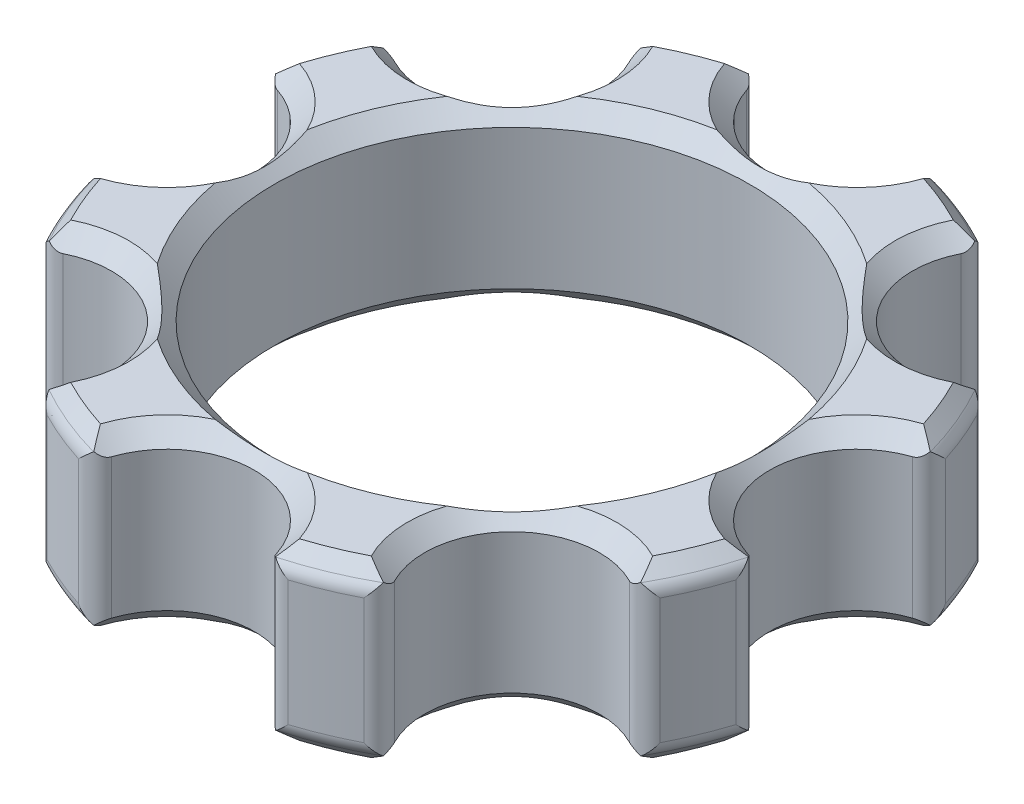
from build123d import *

# Parameters (mm, degrees)
IZIM1_R                     = 13.6
Y_KSEKLIK_EKSTR_ZYON1_DEPTH = 10
PAH1_SIZE                   = 1
RADYUS1_START               = 0.695830358
RADYUS1_2_DEPTH             = 8.608339284


with BuildPart() as part:
    # Çizim1 → Yükseklik-Ekstrüzyon1 (new body)
    with BuildSketch(Plane(origin=(0, 0, 0), x_dir=(1, 0, 0), z_dir=(0, 1, 0))):
        with BuildLine():
            ThreePointArc((19.117088608, -4.959780557), (14.75, 0), (19.117088608, 4.959780557))
            ThreePointArc((19.117088608, 4.959780557), (18.246620767, 7.557997789), (17.024917456, 10.010728526))
            ThreePointArc((17.024917456, 10.010728526), (10.429825023, 10.429825023), (10.010728526, 17.024917456))
            ThreePointArc((10.010728526, 17.024917456), (7.557997789, 18.246620767), (4.959780557, 19.117088608))
            ThreePointArc((4.959780557, 19.117088608), (0, 14.75), (-4.959780557, 19.117088608))
            ThreePointArc((-4.959780557, 19.117088608), (-7.557997789, 18.246620767), (-10.010728526, 17.024917456))
            ThreePointArc((-10.010728526, 17.024917456), (-9.233913483, 15.581967723), (-8.965358928, 13.965358928))
            ThreePointArc((-8.965358928, 13.965358928), (-11.76283681, 9.476606728), (-17.024917456, 10.010728526))
            ThreePointArc((-17.024917456, 10.010728526), (-18.246620767, 7.557997789), (-19.117088608, 4.959780557))
            ThreePointArc((-19.117088608, 4.959780557), (-15.997363796, 3.304197561), (-14.75, 0))
            ThreePointArc((-14.75, 0), (-15.997363796, -3.304197561), (-19.117088608, -4.959780557))
            ThreePointArc((-19.117088608, -4.959780557), (-18.246620767, -7.557997789), (-17.024917456, -10.010728526))
            ThreePointArc((-17.024917456, -10.010728526), (-11.76283681, -9.476606728), (-8.965358928, -13.965358928))
            ThreePointArc((-8.965358928, -13.965358928), (-9.233913483, -15.581967723), (-10.010728526, -17.024917456))
            ThreePointArc((-10.010728526, -17.024917456), (-7.557997789, -18.246620767), (-4.959780557, -19.117088608))
            ThreePointArc((-4.959780557, -19.117088608), (0, -14.75), (4.959780557, -19.117088608))
            ThreePointArc((4.959780557, -19.117088608), (7.557997789, -18.246620767), (10.010728526, -17.024917456))
            ThreePointArc((10.010728526, -17.024917456), (10.429825023, -10.429825023), (17.024917456, -10.010728526))
            ThreePointArc((17.024917456, -10.010728526), (18.246620767, -7.557997789), (19.117088608, -4.959780557))
        make_face()
        with Locations(Location((0, 0, 0), (0, 0, 270))):
            Circle(IZIM1_R, mode=Mode.SUBTRACT)
    extrude(amount=Y_KSEKLIK_EKSTR_ZYON1_DEPTH)

    # Pah1
    # the kernel refuses this chamfer: 1 mm, written as the material it takes off along each edge
    with BuildSketch(Plane(origin=(0, 10, 0), x_dir=(-0.7889082131099503, 0, -0.6145110505822213), z_dir=(0.6145110505822213, 0, -0.7889082131099503))) as pah1_piece_1:
        Polygon((19.75 - PAH1_SIZE, 0), (19.75, -PAH1_SIZE), (19.75, 0), align=None)
    revolve(axis=Axis((0, 10, 0), (0, 1, 0)), revolution_arc=30.832801882, mode=Mode.SUBTRACT)
    with BuildSketch(Plane(origin=(-19.75, 10, 0), x_dir=(-0.37844204482930704, 0, 0.9256249881595746), z_dir=(-0.9256249881595746, 0, -0.37844204482930704))) as pah1_piece_2:
        Polygon((5 + PAH1_SIZE, 0), (5, -PAH1_SIZE), (5, 0), align=None)
    revolve(axis=Axis((-19.75, 10, 0), (0, 1, 0)), revolution_arc=224.474425336, mode=Mode.SUBTRACT)
    with BuildSketch(Plane(origin=(0, 0, 0), x_dir=(0, 0, 1), z_dir=(-1, 0, 0))) as pah1_piece_3:
        Polygon((13.6, PAH1_SIZE), (13.6 + PAH1_SIZE, 0), (13.6, 0), align=None)
    revolve(axis=Axis((0, 0, 0), (0, 1, 0)), mode=Mode.SUBTRACT)
    with BuildSketch(Plane(origin=(0, 0, 0), x_dir=(-0.1233174162430614, 0, -0.9923672782045645), z_dir=(0.9923672782045645, 0, -0.1233174162430614))) as pah1_piece_4:
        Polygon((19.75, PAH1_SIZE), (19.75 - PAH1_SIZE, 0), (19.75, 0), align=None)
    revolve(axis=Axis((0, 0, 0), (0, 1, 0)), revolution_arc=30.832801882, mode=Mode.SUBTRACT)
    with BuildSketch(Plane(origin=(0, 0, -19.75), x_dir=(0.9256249881595718, 0, -0.3784420448293139), z_dir=(-0.3784420448293139, 0, -0.9256249881595718))) as pah1_piece_5:
        Polygon((5, -PAH1_SIZE), (5 + PAH1_SIZE, 0), (5, 0), align=None)
    revolve(axis=Axis((0, 0, -19.75), (0, -1, 0)), revolution_arc=224.474425336, mode=Mode.SUBTRACT)
    with BuildSketch(Plane(origin=(0, 0, 0), x_dir=(0.6145110505822075, 0, -0.7889082131099611), z_dir=(0.7889082131099611, 0, 0.6145110505822075))) as pah1_piece_6:
        Polygon((19.75, PAH1_SIZE), (19.75 - PAH1_SIZE, 0), (19.75, 0), align=None)
    revolve(axis=Axis((0, 0, 0), (0, 1, 0)), revolution_arc=30.832801882, mode=Mode.SUBTRACT)
    with BuildSketch(Plane(origin=(13.965358928, 0, -13.965358928), x_dir=(0.922114642148259, 0, 0.3869167697784474), z_dir=(0.3869167697784474, 0, -0.922114642148259))) as pah1_piece_7:
        Polygon((5, -PAH1_SIZE), (5 + PAH1_SIZE, 0), (5, 0), align=None)
    revolve(axis=Axis((13.965358928, 0, -13.965358928), (0, -1, 0)), revolution_arc=224.474425336, mode=Mode.SUBTRACT)
    with BuildSketch(Plane(origin=(0, 0, 0), x_dir=(0.9923672782045625, 0, -0.123317416243077), z_dir=(0.123317416243077, 0, 0.9923672782045625))) as pah1_piece_8:
        Polygon((19.75 - PAH1_SIZE, 0), (19.75, PAH1_SIZE), (19.75, 0), align=None)
    revolve(axis=Axis((0, 0, 0), (0, 1, 0)), revolution_arc=30.832801882, mode=Mode.SUBTRACT)
    with BuildSketch(Plane(origin=(19.75, 0, 0), x_dir=(0.378442044829287, 0, 0.9256249881595828), z_dir=(0.9256249881595828, 0, -0.378442044829287))) as pah1_piece_9:
        Polygon((5, -PAH1_SIZE), (5 + PAH1_SIZE, 0), (5, 0), align=None)
    revolve(axis=Axis((19.75, 0, 0), (0, -1, 0)), revolution_arc=224.474425336, mode=Mode.SUBTRACT)
    with BuildSketch(Plane(origin=(0, 0, 0), x_dir=(0.7889082131099558, 0, 0.6145110505822139), z_dir=(-0.6145110505822139, 0, 0.7889082131099558))) as pah1_piece_10:
        Polygon((19.75 - PAH1_SIZE, 0), (19.75, PAH1_SIZE), (19.75, 0), align=None)
    revolve(axis=Axis((0, 0, 0), (0, 1, 0)), revolution_arc=30.832801882, mode=Mode.SUBTRACT)
    with BuildSketch(Plane(origin=(13.965358928, 0, 13.965358928), x_dir=(-0.3869167697784496, 0, 0.9221146421482583), z_dir=(0.9221146421482583, 0, 0.3869167697784496))) as pah1_piece_11:
        Polygon((5, -PAH1_SIZE), (5 + PAH1_SIZE, 0), (5, 0), align=None)
    revolve(axis=Axis((13.965358928, 0, 13.965358928), (0, -1, 0)), revolution_arc=224.474425336, mode=Mode.SUBTRACT)
    with BuildSketch(Plane(origin=(0, 10, 0), x_dir=(-0.9923672782045624, 0, 0.1233174162430786), z_dir=(-0.1233174162430786, 0, -0.9923672782045624))) as pah1_piece_12:
        Polygon((19.75 - PAH1_SIZE, 0), (19.75, -PAH1_SIZE), (19.75, 0), align=None)
    revolve(axis=Axis((0, 10, 0), (0, 1, 0)), revolution_arc=30.832801882, mode=Mode.SUBTRACT)
    with BuildSketch(Plane(origin=(0, 0, 0), x_dir=(0.1233174162430511, 0, 0.9923672782045658), z_dir=(-0.9923672782045658, 0, 0.1233174162430511))) as pah1_piece_13:
        Polygon((19.75, PAH1_SIZE), (19.75 - PAH1_SIZE, 0), (19.75, 0), align=None)
    revolve(axis=Axis((0, 0, 0), (0, 1, 0)), revolution_arc=30.832801882, mode=Mode.SUBTRACT)
    with BuildSketch(Plane(origin=(0, 0, 19.75), x_dir=(-0.9256249881595752, 0, 0.3784420448293062), z_dir=(0.3784420448293062, 0, 0.9256249881595752))) as pah1_piece_14:
        Polygon((5, -PAH1_SIZE), (5 + PAH1_SIZE, 0), (5, 0), align=None)
    revolve(axis=Axis((0, 0, 19.75), (0, -1, 0)), revolution_arc=224.474425336, mode=Mode.SUBTRACT)
    with BuildSketch(Plane(origin=(0, 0, 0), x_dir=(-0.6145110505822186, 0, 0.7889082131099524), z_dir=(-0.7889082131099524, 0, -0.6145110505822186))) as pah1_piece_15:
        Polygon((19.75, PAH1_SIZE), (19.75 - PAH1_SIZE, 0), (19.75, 0), align=None)
    revolve(axis=Axis((0, 0, 0), (0, 1, 0)), revolution_arc=30.832801882, mode=Mode.SUBTRACT)
    with BuildSketch(Plane(origin=(-13.965358928, 0, 13.965358928), x_dir=(-0.9221146421482572, 0, -0.3869167697784517), z_dir=(-0.3869167697784517, 0, 0.9221146421482572))) as pah1_piece_16:
        Polygon((5, -PAH1_SIZE), (5 + PAH1_SIZE, 0), (5, 0), align=None)
    revolve(axis=Axis((-13.965358928, 0, 13.965358928), (0, -1, 0)), revolution_arc=224.474425336, mode=Mode.SUBTRACT)
    with BuildSketch(Plane(origin=(0, 0, 0), x_dir=(-0.9923672782045624, 0, 0.12331741624307858), z_dir=(-0.12331741624307858, 0, -0.9923672782045624))) as pah1_piece_17:
        Polygon((19.75, PAH1_SIZE), (19.75 - PAH1_SIZE, 0), (19.75, 0), align=None)
    revolve(axis=Axis((0, 0, 0), (0, 1, 0)), revolution_arc=30.832801882, mode=Mode.SUBTRACT)
    with BuildSketch(Plane(origin=(-19.75, 0, 0), x_dir=(-0.3784420448292879, 0, -0.9256249881595826), z_dir=(-0.9256249881595826, 0, 0.3784420448292879))) as pah1_piece_18:
        Polygon((5, -PAH1_SIZE), (5 + PAH1_SIZE, 0), (5, 0), align=None)
    revolve(axis=Axis((-19.75, 0, 0), (0, -1, 0)), revolution_arc=224.474425336, mode=Mode.SUBTRACT)
    with BuildSketch(Plane(origin=(-13.965358928, 10, 13.965358928), x_dir=(0.38691676977843736, 0, 0.9221146421482634), z_dir=(-0.9221146421482634, 0, 0.38691676977843736))) as pah1_piece_19:
        Polygon((5 + PAH1_SIZE, 0), (5, -PAH1_SIZE), (5, 0), align=None)
    revolve(axis=Axis((-13.965358928, 10, 13.965358928), (0, 1, 0)), revolution_arc=224.474425336, mode=Mode.SUBTRACT)
    with BuildSketch(Plane(origin=(0, 0, 0), x_dir=(-0.7889082131099503, 0, -0.6145110505822213), z_dir=(0.6145110505822213, 0, -0.7889082131099503))) as pah1_piece_20:
        Polygon((19.75, PAH1_SIZE), (19.75 - PAH1_SIZE, 0), (19.75, 0), align=None)
    revolve(axis=Axis((0, 0, 0), (0, 1, 0)), revolution_arc=30.832801882, mode=Mode.SUBTRACT)
    with BuildSketch(Plane(origin=(-13.965358928, 0, -13.965358928), x_dir=(0.38691676977845335, 0, -0.9221146421482566), z_dir=(-0.9221146421482566, 0, -0.38691676977845335))) as pah1_piece_21:
        Polygon((5, -PAH1_SIZE), (5 + PAH1_SIZE, 0), (5, 0), align=None)
    revolve(axis=Axis((-13.965358928, 0, -13.965358928), (0, -1, 0)), revolution_arc=224.474425336, mode=Mode.SUBTRACT)
    with BuildSketch(Plane(origin=(0, 10, 0), x_dir=(-0.6145110505822186, 0, 0.7889082131099524), z_dir=(-0.7889082131099524, 0, -0.6145110505822186))) as pah1_piece_22:
        Polygon((19.75 - PAH1_SIZE, 0), (19.75, -PAH1_SIZE), (19.75, 0), align=None)
    revolve(axis=Axis((0, 10, 0), (0, 1, 0)), revolution_arc=30.832801882, mode=Mode.SUBTRACT)
    with BuildSketch(Plane(origin=(0, 10, 19.75), x_dir=(-0.925624988159575, 0, 0.3784420448293061), z_dir=(0.3784420448293061, 0, 0.925624988159575))) as pah1_piece_23:
        Polygon((5 + PAH1_SIZE, 0), (5, PAH1_SIZE), (5, 0), align=None)
    revolve(axis=Axis((0, 10, 19.75), (0, -1, 0)), revolution_arc=224.474425336, mode=Mode.SUBTRACT)
    with BuildSketch(Plane(origin=(0, 10, 0), x_dir=(0.12331741624305115, 0, 0.9923672782045658), z_dir=(-0.9923672782045658, 0, 0.12331741624305115))) as pah1_piece_24:
        Polygon((19.75 - PAH1_SIZE, 0), (19.75, -PAH1_SIZE), (19.75, 0), align=None)
    revolve(axis=Axis((0, 10, 0), (0, 1, 0)), revolution_arc=30.832801882, mode=Mode.SUBTRACT)
    with BuildSketch(Plane(origin=(13.965358928, 10, 13.965358928), x_dir=(-0.3869167697784496, 0, 0.9221146421482583), z_dir=(0.9221146421482583, 0, 0.3869167697784496))) as pah1_piece_25:
        Polygon((5 + PAH1_SIZE, 0), (5, PAH1_SIZE), (5, 0), align=None)
    revolve(axis=Axis((13.965358928, 10, 13.965358928), (0, -1, 0)), revolution_arc=224.474425336, mode=Mode.SUBTRACT)
    with BuildSketch(Plane(origin=(0, 10, 0), x_dir=(0.7889082131099558, 0, 0.6145110505822139), z_dir=(-0.6145110505822139, 0, 0.7889082131099558))) as pah1_piece_26:
        Polygon((19.75 - PAH1_SIZE, 0), (19.75, -PAH1_SIZE), (19.75, 0), align=None)
    revolve(axis=Axis((0, 10, 0), (0, 1, 0)), revolution_arc=30.832801882, mode=Mode.SUBTRACT)
    with BuildSketch(Plane(origin=(19.75, 10, 0), x_dir=(0.378442044829287, 0, 0.9256249881595829), z_dir=(0.9256249881595829, 0, -0.378442044829287))) as pah1_piece_27:
        Polygon((5, PAH1_SIZE), (5 + PAH1_SIZE, 0), (5, 0), align=None)
    revolve(axis=Axis((19.75, 10, 0), (0, -1, 0)), revolution_arc=224.474425336, mode=Mode.SUBTRACT)
    with BuildSketch(Plane(origin=(0, 10, 0), x_dir=(0.9923672782045625, 0, -0.123317416243077), z_dir=(0.123317416243077, 0, 0.9923672782045625))) as pah1_piece_28:
        Polygon((19.75 - PAH1_SIZE, 0), (19.75, -PAH1_SIZE), (19.75, 0), align=None)
    revolve(axis=Axis((0, 10, 0), (0, 1, 0)), revolution_arc=30.832801882, mode=Mode.SUBTRACT)
    with BuildSketch(Plane(origin=(13.965358928, 10, -13.965358928), x_dir=(0.922114642148259, 0, 0.3869167697784474), z_dir=(0.3869167697784474, 0, -0.922114642148259))) as pah1_piece_29:
        Polygon((5 + PAH1_SIZE, 0), (5, PAH1_SIZE), (5, 0), align=None)
    revolve(axis=Axis((13.965358928, 10, -13.965358928), (0, -1, 0)), revolution_arc=224.474425336, mode=Mode.SUBTRACT)
    with BuildSketch(Plane(origin=(0, 10, 0), x_dir=(0.6145110505822075, 0, -0.7889082131099611), z_dir=(0.7889082131099611, 0, 0.6145110505822075))) as pah1_piece_30:
        Polygon((19.75 - PAH1_SIZE, 0), (19.75, -PAH1_SIZE), (19.75, 0), align=None)
    revolve(axis=Axis((0, 10, 0), (0, 1, 0)), revolution_arc=30.832801882, mode=Mode.SUBTRACT)
    with BuildSketch(Plane(origin=(0, 10, -19.75), x_dir=(0.9256249881595722, 0, -0.37844204482931326), z_dir=(-0.37844204482931326, 0, -0.9256249881595722))) as pah1_piece_31:
        Polygon((5 + PAH1_SIZE, 0), (5, PAH1_SIZE), (5, 0), align=None)
    revolve(axis=Axis((0, 10, -19.75), (0, -1, 0)), revolution_arc=224.474425336, mode=Mode.SUBTRACT)
    with BuildSketch(Plane(origin=(-13.965358928, 10, -13.965358928), x_dir=(-0.9221146421482657, 0, 0.3869167697784318), z_dir=(-0.3869167697784318, 0, -0.9221146421482657))) as pah1_piece_32:
        Polygon((5 + PAH1_SIZE, 0), (5, -PAH1_SIZE), (5, 0), align=None)
    revolve(axis=Axis((-13.965358928, 10, -13.965358928), (0, 1, 0)), revolution_arc=224.474425336, mode=Mode.SUBTRACT)
    with BuildSketch(Plane(origin=(0, 10, 0), x_dir=(-0.12331741624306149, 0, -0.9923672782045645), z_dir=(0.9923672782045645, 0, -0.12331741624306149))) as pah1_piece_33:
        Polygon((19.75 - PAH1_SIZE, 0), (19.75, -PAH1_SIZE), (19.75, 0), align=None)
    revolve(axis=Axis((0, 10, 0), (0, 1, 0)), revolution_arc=30.832801882, mode=Mode.SUBTRACT)
    with BuildSketch(Plane(origin=(0, 10, 0), x_dir=(0, 0, 1), z_dir=(-1, 0, 0))) as pah1_piece_34:
        Polygon((13.6 + PAH1_SIZE, 0), (13.6, -PAH1_SIZE), (13.6, 0), align=None)
    revolve(axis=Axis((0, 10, 0), (0, 1, 0)), mode=Mode.SUBTRACT)

    # Radyus1: read off the stored shape, not the designer's step
    # Radyus1 outline → Radyus1 (revolve, cut)
    with BuildSketch(Plane.XY):
        with BuildLine():
            Line((19.75, 0.707106781), (19.75, 1.414213562))
            ThreePointArc((19.75, 1.414213562), (19.673879533, 1.03153013), (19.457106781, 0.707106781))
            Line((19.457106781, 0.707106781), (19.75, 0.707106781))
        make_face()
        with BuildLine():
            ThreePointArc((19.457106781, 9.292893219), (19.673879533, 8.96846987), (19.75, 8.585786438))
            Line((19.75, 8.585786438), (19.75, 9.292893219))
            Line((19.75, 9.292893219), (19.457106781, 9.292893219))
        make_face()
    revolve(axis=Axis((0, 0, 0), (0, 1, 0)), mode=Mode.SUBTRACT)

    # Radyus1 2 outline → Radyus1 2 (cut)
    with BuildSketch(Plane(origin=(0, 0, 0), x_dir=(1, 0, 0), z_dir=(0, 1, 0)).offset(RADYUS1_START)):
        with BuildLine():
            ThreePointArc((18.178270042, -4.746542419), (18.754954503, -5.241907368), (18.816666667, -5.999629618))
            ThreePointArc((18.816666667, -5.999629618), (18.974002446, -5.48176351), (19.117088608, -4.959780557))
            ThreePointArc((19.117088608, -4.959780557), (18.642535104, -4.875809831), (18.178270042, -4.746542419))
        make_face()
        with BuildLine():
            ThreePointArc((17.024917456, -10.010728526), (17.292837947, -9.540453645), (17.547771387, -9.063013812))
            ThreePointArc((17.547771387, -9.063013812), (16.968343756, -9.555167263), (16.210290349, -9.497665685))
            ThreePointArc((16.210290349, -9.497665685), (16.629981185, -9.734544795), (17.024917456, -10.010728526))
        make_face()
        with BuildLine():
            ThreePointArc((18.816666667, 5.999629618), (18.754954503, 5.241907368), (18.178270042, 4.746542419))
            ThreePointArc((18.178270042, 4.746542419), (18.642535104, 4.875809831), (19.117088608, 4.959780557))
            ThreePointArc((19.117088608, 4.959780557), (18.974002446, 5.48176351), (18.816666667, 5.999629618))
        make_face()
        with BuildLine():
            ThreePointArc((10.010728526, -17.024917456), (9.734544795, -16.629981185), (9.497665685, -16.210290349))
            ThreePointArc((9.497665685, -16.210290349), (9.555167263, -16.968343756), (9.063013812, -17.547771387))
            ThreePointArc((9.063013812, -17.547771387), (9.540453645, -17.292837947), (10.010728526, -17.024917456))
        make_face()
        with BuildLine():
            ThreePointArc((16.210290349, 9.497665685), (16.968343756, 9.555167263), (17.547771387, 9.063013812))
            ThreePointArc((17.547771387, 9.063013812), (17.292837947, 9.540453645), (17.024917456, 10.010728526))
            ThreePointArc((17.024917456, 10.010728526), (16.629981185, 9.734544795), (16.210290349, 9.497665685))
        make_face()
        with BuildLine():
            ThreePointArc((4.959780557, -19.117088608), (5.48176351, -18.974002446), (5.999629618, -18.816666667))
            ThreePointArc((5.999629618, -18.816666667), (5.241907368, -18.754954503), (4.746542419, -18.178270042))
            ThreePointArc((4.746542419, -18.178270042), (4.875809831, -18.642535104), (4.959780557, -19.117088608))
        make_face()
        with BuildLine():
            ThreePointArc((9.063013812, 17.547771387), (9.555167263, 16.968343756), (9.497665685, 16.210290349))
            ThreePointArc((9.497665685, 16.210290349), (9.734544795, 16.629981185), (10.010728526, 17.024917456))
            ThreePointArc((10.010728526, 17.024917456), (9.540453645, 17.292837947), (9.063013812, 17.547771387))
        make_face()
        with BuildLine():
            ThreePointArc((-4.959780557, -19.117088608), (-4.875809831, -18.642535104), (-4.74654242, -18.178270042))
            ThreePointArc((-4.74654242, -18.178270042), (-5.241907368, -18.754954503), (-5.999629618, -18.816666667))
            ThreePointArc((-5.999629618, -18.816666667), (-5.48176351, -18.974002446), (-4.959780557, -19.117088608))
        make_face()
        with BuildLine():
            ThreePointArc((4.746542419, 18.178270042), (5.241907368, 18.754954503), (5.999629618, 18.816666667))
            ThreePointArc((5.999629618, 18.816666667), (5.48176351, 18.974002446), (4.959780557, 19.117088608))
            ThreePointArc((4.959780557, 19.117088608), (4.875809831, 18.642535104), (4.746542419, 18.178270042))
        make_face()
        with BuildLine():
            ThreePointArc((-10.010728526, -17.024917456), (-9.540453645, -17.292837947), (-9.063013812, -17.547771387))
            ThreePointArc((-9.063013812, -17.547771387), (-9.555167263, -16.968343756), (-9.497665685, -16.210290349))
            ThreePointArc((-9.497665685, -16.210290349), (-9.734544795, -16.629981185), (-10.010728526, -17.024917456))
        make_face()
        with BuildLine():
            ThreePointArc((-5.999629618, 18.816666667), (-5.241907368, 18.754954503), (-4.746542419, 18.178270042))
            ThreePointArc((-4.746542419, 18.178270042), (-4.875809831, 18.642535104), (-4.959780557, 19.117088608))
            ThreePointArc((-4.959780557, 19.117088608), (-5.48176351, 18.974002446), (-5.999629618, 18.816666667))
        make_face()
        with BuildLine():
            ThreePointArc((-17.024917456, -10.010728526), (-16.629981185, -9.734544795), (-16.210290349, -9.497665685))
            ThreePointArc((-16.210290349, -9.497665685), (-16.968343756, -9.555167263), (-17.547771387, -9.063013812))
            ThreePointArc((-17.547771387, -9.063013812), (-17.292837947, -9.540453645), (-17.024917456, -10.010728526))
        make_face()
        with BuildLine():
            ThreePointArc((-9.497665685, 16.210290349), (-9.555167263, 16.968343756), (-9.063013812, 17.547771387))
            ThreePointArc((-9.063013812, 17.547771387), (-9.540453645, 17.292837947), (-10.010728526, 17.024917456))
            ThreePointArc((-10.010728526, 17.024917456), (-9.734544795, 16.629981185), (-9.497665685, 16.210290349))
        make_face()
        with BuildLine():
            ThreePointArc((-19.117088608, -4.959780557), (-18.974002446, -5.48176351), (-18.816666667, -5.999629618))
            ThreePointArc((-18.816666667, -5.999629618), (-18.754954503, -5.241907368), (-18.178270042, -4.746542419))
            ThreePointArc((-18.178270042, -4.746542419), (-18.642535104, -4.875809831), (-19.117088608, -4.959780557))
        make_face()
        with BuildLine():
            ThreePointArc((-17.547771387, 9.063013812), (-16.968343756, 9.555167263), (-16.210290349, 9.497665685))
            ThreePointArc((-16.210290349, 9.497665685), (-16.629981185, 9.734544795), (-17.024917456, 10.010728526))
            ThreePointArc((-17.024917456, 10.010728526), (-17.292837947, 9.540453645), (-17.547771387, 9.063013812))
        make_face()
        with BuildLine():
            ThreePointArc((-19.117088608, 4.959780557), (-18.642535104, 4.875809831), (-18.178270042, 4.74654242))
            ThreePointArc((-18.178270042, 4.74654242), (-18.754954503, 5.241907368), (-18.816666667, 5.999629618))
            ThreePointArc((-18.816666667, 5.999629618), (-18.974002446, 5.48176351), (-19.117088608, 4.959780557))
        make_face()
    extrude(amount=RADYUS1_2_DEPTH, mode=Mode.SUBTRACT)


solid = part.part
